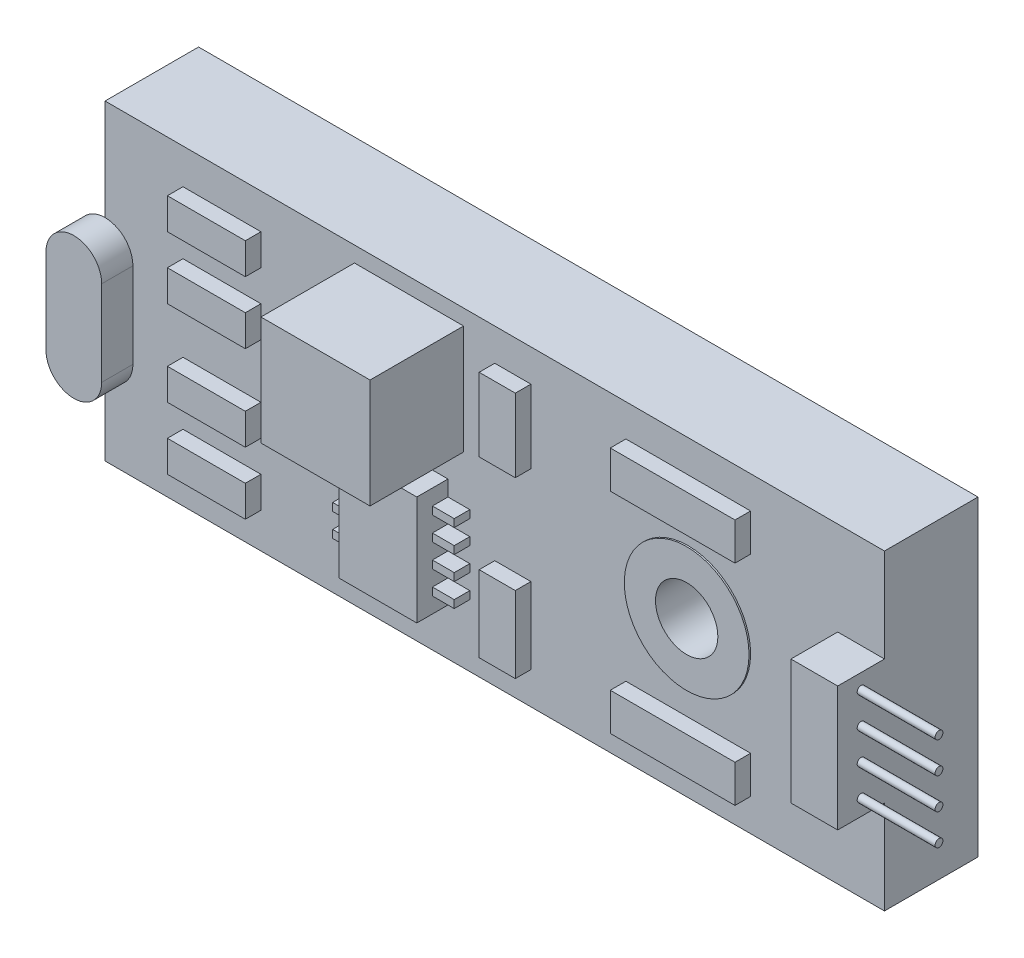
from build123d import *

# Parameters (mm, degrees)
CROQUIS1_W               = 25
CROQUIS1_H               = 10
SALIENTE_EXTRUIR1_DEPTH  = 3
CORTAR_EXTRUIR1_REACH    = 15.793
CROQUIS2_R               = 1
CROQUIS2_3_R             = 2
CROQUIS2_3_R_2           = 1
SALIENTE_EXTRUIR2_DEPTH  = 0.05
CROQUIS3_W               = 3.5
CROQUIS3_H               = 3.5
SALIENTE_EXTRUIR3_DEPTH  = 3
CROQUIS4_W               = 2.5
CROQUIS4_H               = 3.5
SALIENTE_EXTRUIR4_DEPTH  = 1
CROQUIS5_W               = 0.7
CROQUIS5_H               = 0.25
SALIENTE_EXTRUIR5_DEPTH  = 0.5
CROQUIS6_W               = 2.5
CROQUIS6_H               = 1
CROQUIS6_W_2             = 4
CROQUIS6_H_2             = 1.2
SALIENTE_EXTRUIR6_DEPTH  = 0.5
CROQUIS7_W               = 2.5
CROQUIS7_H               = 1
CROQUIS7_W_2             = 4
CROQUIS7_H_2             = 1.2
SALIENTE_EXTRUIR7_DEPTH  = 0.5
CROQUIS8_W               = 1.5
CROQUIS8_H               = 4
SALIENTE_EXTRUIR8_DEPTH  = 1.5
CROQUIS9_R               = 0.125
SALIENTE_EXTRUIR9_DEPTH  = 2.5
SALIENTE_EXTRUIR11_DEPTH = 1
CROQUIS12_W              = 1.159197975
CROQUIS12_H              = 2.351229057
CROQUIS12_H_2            = 2.446151106
SALIENTE_EXTRUIR12_DEPTH = 0.5


with BuildPart() as part:
    # Croquis1 → Saliente-Extruir1 (new body)
    with BuildSketch(Plane.XY):
        Rectangle(CROQUIS1_W, CROQUIS1_H)
    extrude(amount=SALIENTE_EXTRUIR1_DEPTH)

    # Croquis2 → Cortar-Extruir1 (cut, up to next)
    with BuildSketch(Plane.XY.offset(3), mode=Mode.PRIVATE) as cortar_extruir1_sk1:
        with Locations((6.205608074, 0)):
            Circle(CROQUIS2_R)
    cortar_extruir1_tool1 = extrude(cortar_extruir1_sk1.sketch, amount=-CORTAR_EXTRUIR1_REACH, mode=Mode.PRIVATE) & part.part
    add(cortar_extruir1_tool1.solids().sort_by_distance((6.205608, 0, 3))[0], mode=Mode.SUBTRACT)

    # Croquis2<3> → Saliente-Extruir2 (add, symmetric)
    with BuildSketch(Plane.XY.offset(3)):
        with Locations((6.205608074, 0)):
            Circle(CROQUIS2_3_R)
        with Locations((6.205608074, 0)):
            Circle(CROQUIS2_3_R_2, mode=Mode.SUBTRACT)
    extrude(amount=SALIENTE_EXTRUIR2_DEPTH, both=True)

    # Croquis3 → Saliente-Extruir3 (add)
    with BuildSketch(Plane.XY.offset(3)):
        with Locations((-2.75, 2.75)):
            Rectangle(CROQUIS3_W, CROQUIS3_H)
    extrude(amount=SALIENTE_EXTRUIR3_DEPTH)

    # Croquis4 → Saliente-Extruir4 (add)
    with BuildSketch(Plane.XY.offset(3)):
        with Locations((-2.75, -1.75)):
            Rectangle(CROQUIS4_W, CROQUIS4_H)
    extrude(amount=SALIENTE_EXTRUIR4_DEPTH)

    # Croquis5 → Saliente-Extruir5 (add)
    with BuildSketch(Plane.XY.offset(3)):
        with Locations((-4.35, -0.625)):
            Rectangle(CROQUIS5_W, CROQUIS5_H)
        with Locations((-4.35, -1.375)):
            Rectangle(CROQUIS5_W, CROQUIS5_H)
        with Locations((-4.35, -2.125)):
            Rectangle(CROQUIS5_W, CROQUIS5_H)
        with Locations((-4.35, -2.875)):
            Rectangle(CROQUIS5_W, CROQUIS5_H)
        with Locations((-1.15, -2.875)):
            Rectangle(CROQUIS5_W, CROQUIS5_H)
        with Locations((-1.15, -2.125)):
            Rectangle(CROQUIS5_W, CROQUIS5_H)
        with Locations((-1.15, -1.375)):
            Rectangle(CROQUIS5_W, CROQUIS5_H)
        with Locations((-1.15, -0.625)):
            Rectangle(CROQUIS5_W, CROQUIS5_H)
    extrude(amount=SALIENTE_EXTRUIR5_DEPTH)

    # Croquis6 → Saliente-Extruir6 (add)
    with BuildSketch(Plane.XY.offset(3)):
        with Locations((-8.75, 3.368697132)):
            Rectangle(CROQUIS6_W, CROQUIS6_H)
        with Locations((-8.75, 1.368697132)):
            Rectangle(CROQUIS6_W, CROQUIS6_H)
        with Locations((6.205608074, -3.364903889)):
            Rectangle(CROQUIS6_W_2, CROQUIS6_H_2)
    extrude(amount=SALIENTE_EXTRUIR6_DEPTH)

    # Croquis7 → Saliente-Extruir7 (add)
    with BuildSketch(Plane.XY.offset(3)):
        with Locations((-8.75, -1.368697132)):
            Rectangle(CROQUIS7_W, CROQUIS7_H)
        with Locations((6.205608074, 3.364903889)):
            Rectangle(CROQUIS7_W_2, CROQUIS7_H_2)
        with Locations((-8.75, -3.368697132)):
            Rectangle(CROQUIS7_W, CROQUIS7_H)
        with Locations((6.205608074, -3.364903889)):
            Rectangle(CROQUIS7_W_2, CROQUIS7_H_2)
    extrude(amount=SALIENTE_EXTRUIR7_DEPTH)



with BuildPart() as body_2:
    # Croquis8 → Saliente-Extruir8 (new body)
    with BuildSketch(Plane.XY.offset(3)):
        with Locations((11.75, 0)):
            Rectangle(CROQUIS8_W, CROQUIS8_H)
    extrude(amount=SALIENTE_EXTRUIR8_DEPTH)


with BuildPart() as part_1:
    add(part.part)

    add(body_2.part)  # Saliente-Extruir9 merges body 2
    # Croquis9 → Saliente-Extruir9 (add)
    with BuildSketch(Plane(origin=(12.5, 0, 0), x_dir=(0, 0, -1), z_dir=(1, 0, 0))):
        with Locations((-3.75, 1.514222449)):
            Circle(CROQUIS9_R)
        with Locations((-3.75, 0.514222449)):
            Circle(CROQUIS9_R)
        with Locations((-3.75, -0.485777551)):
            Circle(CROQUIS9_R)
        with Locations((-3.75, -1.485777551)):
            Circle(CROQUIS9_R)
    extrude(amount=SALIENTE_EXTRUIR9_DEPTH)

    # Croquis11 → Saliente-Extruir11 (add)
    with BuildSketch(Plane.XY.offset(3)):
        with BuildLine():
            Line((-11.606480583, 0.868697132), (-11.606480583, -1.868697132))
            ThreePointArc((-11.606480583, -1.868697132), (-12.5, -2.762216549), (-13.393519417, -1.868697132))
            Line((-13.393519417, -1.868697132), (-13.393519417, 0.868697132))
            ThreePointArc((-13.393519417, 0.868697132), (-12.5, 1.762216549), (-11.606480583, 0.868697132))
        make_face()
    extrude(amount=SALIENTE_EXTRUIR11_DEPTH)

    # Croquis12 → Saliente-Extruir12 (add)
    with BuildSketch(Plane.XY.offset(3)):
        with Locations((0.579598988, 2.789289361)):
            Rectangle(CROQUIS12_W, CROQUIS12_H)
        with Locations((0.579598988, -2.741828336)):
            Rectangle(CROQUIS12_W, CROQUIS12_H_2)
    extrude(amount=SALIENTE_EXTRUIR12_DEPTH)


solid = part_1.part
